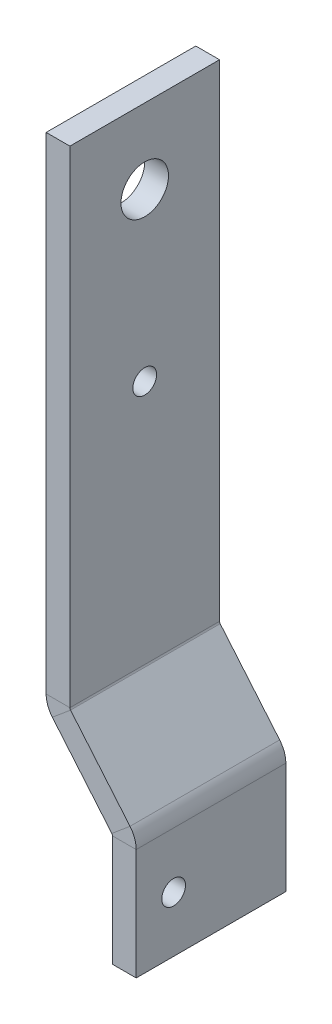
from build123d import *

# Parameters (mm, degrees)
SKETCH1_W          = 40
SKETCH1_H          = 130
SKETCH1_R          = 6.35
SKETCH1_R_2        = 3.175
BASE_FLANGE1_DEPTH = 6.35
EDGE_FLANGE1_DEPTH = 40
EDGE_FLANGE2_DEPTH = 40
SKETCH20_R         = 3.175
CUT_EXTRUDE3_DEPTH = 6.35


# Sheet-metal steps are written as plain solids
with BuildPart() as part:
    # Sketch1 → Base-Flange1 (new body)
    with BuildSketch(Plane(origin=(0, 0, 0), x_dir=(0, 0, -1), z_dir=(1, 0, 0))):
        with Locations((20, -65)):
            Rectangle(SKETCH1_W, SKETCH1_H)
        with Locations((20, -20)):
            Circle(SKETCH1_R, mode=Mode.SUBTRACT)
        with Locations((20, -64.45)):
            Circle(SKETCH1_R_2, mode=Mode.SUBTRACT)
    extrude(amount=-BASE_FLANGE1_DEPTH)

    # Edge-Flange1 section (across the edge) → Edge-Flange1 (add)
    with BuildSketch(Plane(origin=(0, -130.268100475, 0), x_dir=(0.7660444431189817, 0.642787609686535, 0), z_dir=(0, 0, -1))):
        with BuildLine():
            Line((-6.35, 0.268100475), (-6.35, 25))
            Line((-6.35, 25), (0, 25))
            Line((0, 25), (0, 0.268100475))
            ThreePointArc((0, 0.268100475), (0.044422416, 0.016168437), (0.172331663, -0.205376879))
            Line((0.172331663, -0.205376879), (-4.692050551, -4.2870782))
            ThreePointArc((-4.692050551, -4.2870782), (-5.922625726, -2.155659473), (-6.35, 0.268100475))
        make_face()
    extrude(amount=EDGE_FLANGE1_DEPTH)

    # Edge-Flange2 section (across the edge) → Edge-Flange2 (add)
    with BuildSketch(Plane(origin=(11.377639692, -153.706289753, -40), x_dir=(-1, 0, 0), z_dir=(0, 0, 1))):
        with BuildLine():
            Line((-6.35, 0.268100475), (-6.35, 30))
            Line((-6.35, 30), (0, 30))
            Line((0, 30), (0, 0.268100475))
            ThreePointArc((0, 0.268100475), (0.044422416, 0.016168437), (0.172331663, -0.205376879))
            Line((0.172331663, -0.205376879), (-4.692050551, -4.2870782))
            ThreePointArc((-4.692050551, -4.2870782), (-5.922625726, -2.155659473), (-6.35, 0.268100475))
        make_face()
    extrude(amount=EDGE_FLANGE2_DEPTH)

    # Sketch20 → Cut-Extrude3 (cut)
    with BuildSketch(Plane(origin=(17.727639692, 0, 0), x_dir=(0, 0, -1), z_dir=(1, 0, 0))):
        with Locations(Location((10, -168.84033999, 0), (0, 0, 90))):
            Circle(SKETCH20_R)
    extrude(amount=-CUT_EXTRUDE3_DEPTH, mode=Mode.SUBTRACT)


solid = part.part
